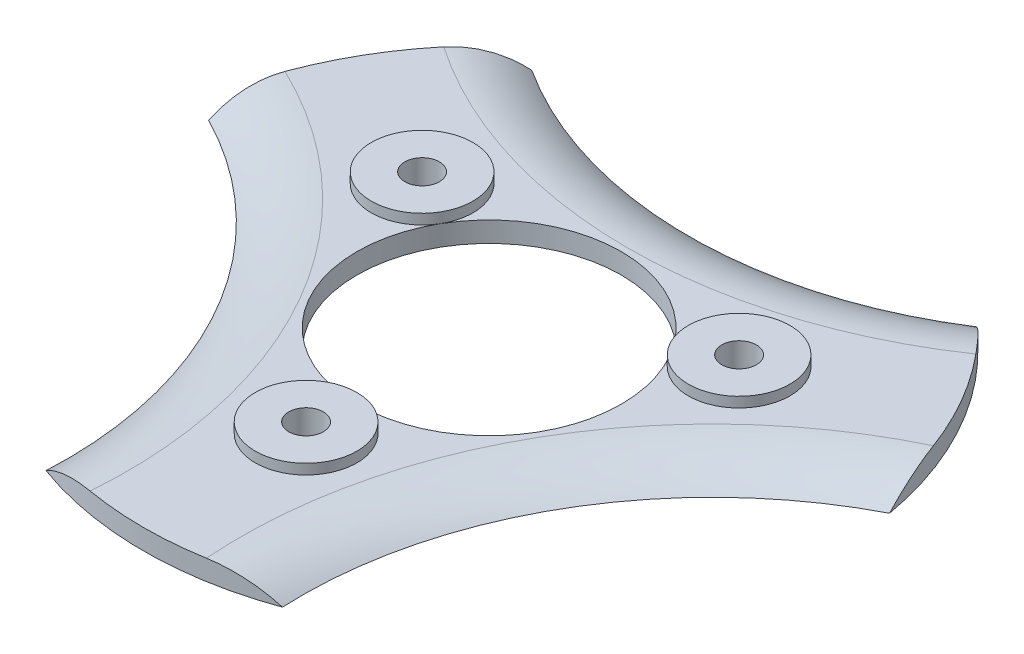
from build123d import *

# Parameters (mm, degrees)
SKETCH1_R           = 34
SKETCH1_R_2         = 1.6999999999999995
SKETCH1_R_3         = 1.7
SKETCH1_R_4         = 13
BOSS_EXTRUDE1_DEPTH = 2
SKETCH3_R           = 40.37992907465996
CUT_EXTRUDE1_DEPTH  = 2
SKETCH4_R           = 5.000000000000001
SKETCH4_R_2         = 1.6999999999999995
BOSS_EXTRUDE2_DEPTH = 1
CIRPATTERN1_COUNT   = 3
FILLET1_ANGLE       = 68.695952
FILLET1_2_ANGLE     = 68.695952
FILLET1_3_ANGLE     = 68.695952


with BuildPart() as part:
    # Sketch1 → Boss-Extrude1 (new body)
    with BuildSketch(Plane(origin=(0, 0, 0), x_dir=(1, 0, 0), z_dir=(0, 1, 0))):
        with Locations(Location((0, 0, 0), (0, 0, 270))):
            Circle(SKETCH1_R)
        with Locations(Location((15.58845, 8.99999580374902, 0), (0, 0, 270))):
            Circle(SKETCH1_R_2, mode=Mode.SUBTRACT)
        with Locations(Location((1.73e-15, -17.999991607498043, 0), (0, 0, 270))):
            Circle(SKETCH1_R_3, mode=Mode.SUBTRACT)
        with Locations(Location((-15.588449999999993, 8.999995803749012, 0), (0, 0, 270))):
            Circle(SKETCH1_R_2, mode=Mode.SUBTRACT)
        with Locations(Location((0, 0, 0), (0, 0, 270))):
            Circle(SKETCH1_R_4, mode=Mode.SUBTRACT)
    extrude(amount=BOSS_EXTRUDE1_DEPTH)

    # Sketch3 → Cut-Extrude1 (cut)
    with BuildSketch(Plane(origin=(0, 2, 0), x_dir=(1, 0, 0), z_dir=(0, 1, 0))):
        with Locations((51.96152422706632, -29.999999999999986)):
            Circle(SKETCH3_R)
    cut_extrude1 = extrude(amount=-CUT_EXTRUDE1_DEPTH, mode=Mode.SUBTRACT)

    # Sketch4 → Boss-Extrude2 (add)
    with BuildSketch(Plane(origin=(0, 2, 0), x_dir=(1, 0, 0), z_dir=(0, 1, 0))):
        with Locations(Location((-15.588449999999993, 8.999995803749012, 0), (0, 0, 330))):
            Circle(SKETCH4_R)
        with Locations(Location((-15.588449999999993, 8.999995803749012, 0), (0, 0, 270))):
            Circle(SKETCH4_R_2, mode=Mode.SUBTRACT)
    boss_extrude2 = extrude(amount=BOSS_EXTRUDE2_DEPTH)

    # CirPattern1: Cut-Extrude1, Boss-Extrude2 ×3 about axis
    cirpattern1_axis = Axis((-1.58e-15, 0, 2.4e-16), (0, 1, 0))
    add([cut_extrude1.rotate(cirpattern1_axis, i * 360 / CIRPATTERN1_COUNT) for i in range(1, CIRPATTERN1_COUNT)], mode=Mode.SUBTRACT)
    add([boss_extrude2.rotate(cirpattern1_axis, i * 360 / CIRPATTERN1_COUNT) for i in range(1, CIRPATTERN1_COUNT)])

    # Fillet1: read off the stored shape, not the designer's step
    # Fillet1 outline → Fillet1 (revolve, cut)
    with BuildSketch(Plane(origin=(0, 0, -60), x_dir=(-0.5642175786181923, 0, 0.8256261405613463), z_dir=(-0.8256261405613463, 0, -0.5642175786181923))):
        with BuildLine():
            ThreePointArc((40.379929075, 0), (43.217651415, 1.486832981), (46.379929075, 2))
            Line((46.379929075, 2), (40.379929075, 2))
            Line((40.379929075, 2), (40.379929075, 0))
        make_face()
    revolve(axis=Axis((0, 0, -60), (0, 1, 0)), revolution_arc=FILLET1_ANGLE, mode=Mode.SUBTRACT)

    # Fillet1 2 outline → Fillet1 2 (revolve, cut)
    with BuildSketch(Plane(origin=(-51.961524227, 0, 30), x_dir=(0.9971220010637243, 0, 0.07581368606441925), z_dir=(-0.07581368606441925, 0, 0.9971220010637243))):
        with BuildLine():
            ThreePointArc((40.379929075, 0), (43.217651415, 1.486832981), (46.379929075, 2))
            Line((46.379929075, 2), (40.379929075, 2))
            Line((40.379929075, 2), (40.379929075, 0))
        make_face()
    revolve(axis=Axis((-51.961524227, 0, 30), (0, 1.0000000000000002, 0)), revolution_arc=FILLET1_2_ANGLE, mode=Mode.SUBTRACT)

    # Fillet1 3 outline → Fillet1 3 (revolve, cut)
    with BuildSketch(Plane(origin=(51.961524227, 0, 30), x_dir=(-0.43290442244553945, 0, -0.9014398266257676), z_dir=(0.9014398266257676, 0, -0.43290442244553945))):
        with BuildLine():
            ThreePointArc((40.379929075, 0), (43.217651415, 1.486832981), (46.379929075, 2))
            Line((46.379929075, 2), (40.379929075, 2))
            Line((40.379929075, 2), (40.379929075, 0))
        make_face()
    revolve(axis=Axis((51.961524227, 0, 30), (0, 1, 0)), revolution_arc=FILLET1_3_ANGLE, mode=Mode.SUBTRACT)


solid = part.part
